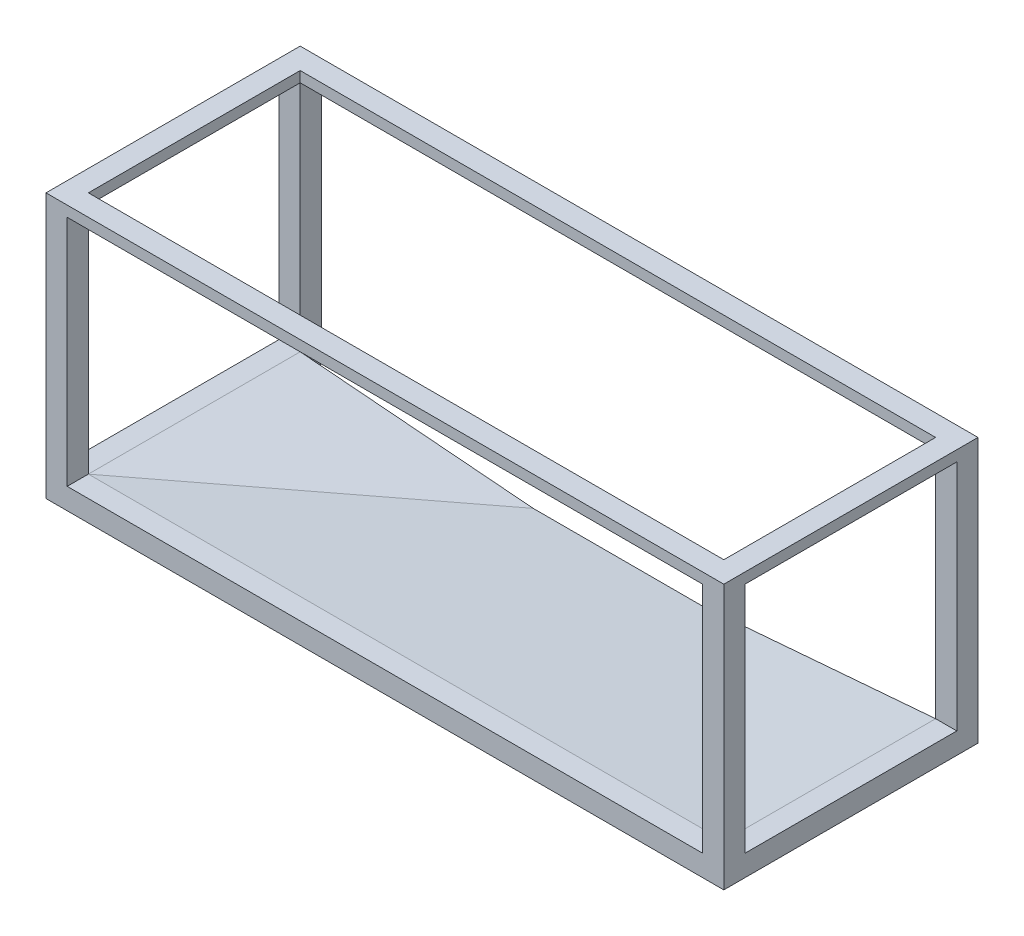
from build123d import *

# Parameters (mm, degrees)
SKETCH1_W                                  = 406.4
SKETCH1_H                                  = 152.4
SKETCH1_W_2                                = 381
SKETCH1_H_2                                = 127
BOSS_EXTRUDE1_DEPTH                        = 12.7
SKETCH2_W                                  = 12.7
SKETCH2_H                                  = 12.7
BOSS_EXTRUDE2_DEPTH                        = 146.05
MIRROR1_AT_THE_SECOND_PLANE_COPY_1_SKETC_W = 12.7
MIRROR1_AT_THE_SECOND_PLANE_COPY_1_SKETC_H = 12.7
MIRROR1_AT_THE_SECOND_PLANE_COPY_1_DEPTH   = 146.05
SKETCH3_W                                  = 406.4
SKETCH3_H                                  = 152.4
SKETCH3_W_2                                = 381
SKETCH3_H_2                                = 127
BOSS_EXTRUDE3_DEPTH                        = 6.35
SKETCH6_W                                  = 12.7
SKETCH6_H                                  = 12.7
CUT_EXTRUDE1_DEPTH                         = 381
BOSS_EXTRUDE5_DEPTH                        = 381
CUT_EXTRUDE3_DEPTH                         = 262.586090035
LOFT2_START                                = -63.5
LOFT2_DEPTH                                = 127
LOFT3_START                                = -63.5
LOFT3_DEPTH                                = 127


# Read off the part's stored shape, not the designer's step: Loft2, Loft3
with BuildPart() as part:
    # Sketch1 → Boss-Extrude1 (new body)
    with BuildSketch(Plane(origin=(0, 0, 0), x_dir=(1, 0, 0), z_dir=(0, 1, 0))):
        Rectangle(SKETCH1_W, SKETCH1_H)
        Rectangle(SKETCH1_W_2, SKETCH1_H_2, mode=Mode.SUBTRACT)
    extrude(amount=BOSS_EXTRUDE1_DEPTH)

    # Sketch2 → Boss-Extrude2 (add)
    with BuildSketch(Plane(origin=(0, 12.7, 0), x_dir=(1, 0, 0), z_dir=(0, 1, 0))):
        with Locations((-196.85, -69.85)):
            Rectangle(SKETCH2_W, SKETCH2_H)
    boss_extrude2 = extrude(amount=BOSS_EXTRUDE2_DEPTH)

    # Mirror1: Boss-Extrude2 across plane
    add(boss_extrude2.mirror(Plane(origin=(0, 0, 0), x_dir=(0, 0, 1), z_dir=(1, 0, 0))))

    # Mirror1 at the second plane: Boss-Extrude2 across plane
    add(boss_extrude2.mirror(Plane.XY))

    # Mirror1 at the second plane copy 1 sketc → Mirror1 at the second plane copy 1 (add)
    with BuildSketch(Plane(origin=(0, 12.7, 0), x_dir=(-1, 0, 0), z_dir=(0, 1, 0))):
        with Locations((-196.85, -69.85)):
            Rectangle(MIRROR1_AT_THE_SECOND_PLANE_COPY_1_SKETC_W, MIRROR1_AT_THE_SECOND_PLANE_COPY_1_SKETC_H)
    extrude(amount=MIRROR1_AT_THE_SECOND_PLANE_COPY_1_DEPTH)

    # Sketch3 → Boss-Extrude3 (add)
    with BuildSketch(Plane(origin=(0, 158.75, 0), x_dir=(1, 0, 0), z_dir=(0, 1, 0))):
        Rectangle(SKETCH3_W, SKETCH3_H)
        Rectangle(SKETCH3_W_2, SKETCH3_H_2, mode=Mode.SUBTRACT)
    extrude(amount=-BOSS_EXTRUDE3_DEPTH)

    # Sketch6 → Cut-Extrude1 (cut)
    with BuildSketch(Plane.ZY.offset(-190.5)):
        with Locations((-69.85, 6.35)):
            Rectangle(SKETCH6_W, SKETCH6_H)
    extrude(amount=CUT_EXTRUDE1_DEPTH, mode=Mode.SUBTRACT)

    # Sketch4 → Boss-Extrude5 (add)
    with BuildSketch(Plane.ZY.offset(-190.5)):
        Polygon((-63.5, 0), (63.5, 0), (63.5, 12.7), (-63.5, 1.27), align=None)
    extrude(amount=BOSS_EXTRUDE5_DEPTH)

    # Sketch10 → Cut-Extrude3 (cut, through all)
    with BuildSketch(Plane(origin=(0, 12.7, 0), x_dir=(1, 0, 0), z_dir=(0, 1, 0))):
        Polygon((-190.5, -63.5), (-190.5, 63.5), (-50.8, 63.5), align=None)
        Polygon((190.5, -63.5), (190.5, 63.5), (50.8, 63.5), align=None)
    extrude(amount=-CUT_EXTRUDE3_DEPTH, mode=Mode.SUBTRACT)

    # Loft2 outline → Loft2 (add)
    with BuildSketch(Plane.XY.offset(LOFT2_START)):
        Polygon((49, 1.122727273), (49, 0), (190.5, 0), (190.5, 12.7), (50.8, 1.27), align=None)
    extrude(amount=LOFT2_DEPTH)

    # Loft3 outline → Loft3 (add)
    with BuildSketch(Plane.XY.offset(LOFT3_START)):
        Polygon((-190.5, 12.7), (-190.5, 0), (-49, 0), (-49, 1.122727273), (-50.8, 1.27), align=None)
    extrude(amount=LOFT3_DEPTH)


solid = part.part
